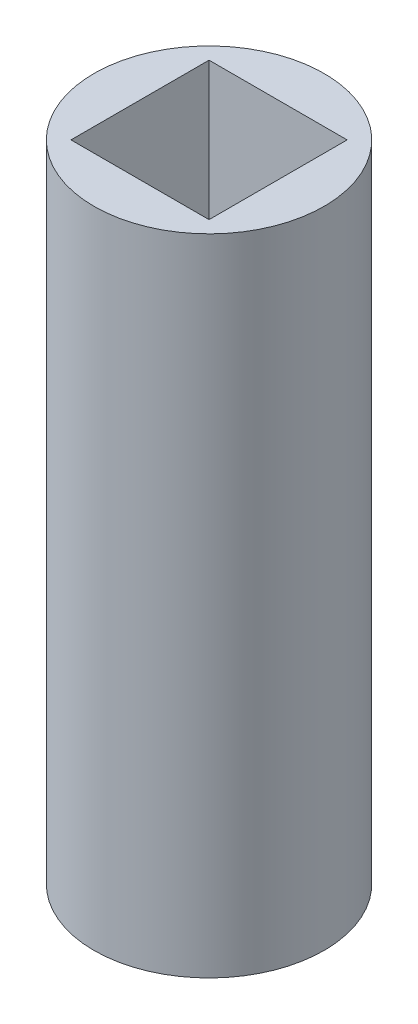
from build123d import *

# Parameters (mm, degrees)
SKETCH1_R           = 15.875
BOSS_EXTRUDE1_DEPTH = 88.9
SKETCH2_W           = 19.05
SKETCH2_H           = 19.05
CUT_EXTRUDE1_DEPTH  = 172.72


with BuildPart() as part:
    # Sketch1 → Boss-Extrude1 (new body)
    with BuildSketch(Plane(origin=(0, 0, 0), x_dir=(1, 0, 0), z_dir=(0, 1, 0))):
        Circle(SKETCH1_R)
    extrude(amount=BOSS_EXTRUDE1_DEPTH)

    # Sketch2 → Cut-Extrude1 (cut)
    with BuildSketch(Plane(origin=(0, 88.9, 0), x_dir=(1, 0, 0), z_dir=(0, 1, 0))):
        Rectangle(SKETCH2_W, SKETCH2_H)
    extrude(amount=-CUT_EXTRUDE1_DEPTH, mode=Mode.SUBTRACT)


solid = part.part
